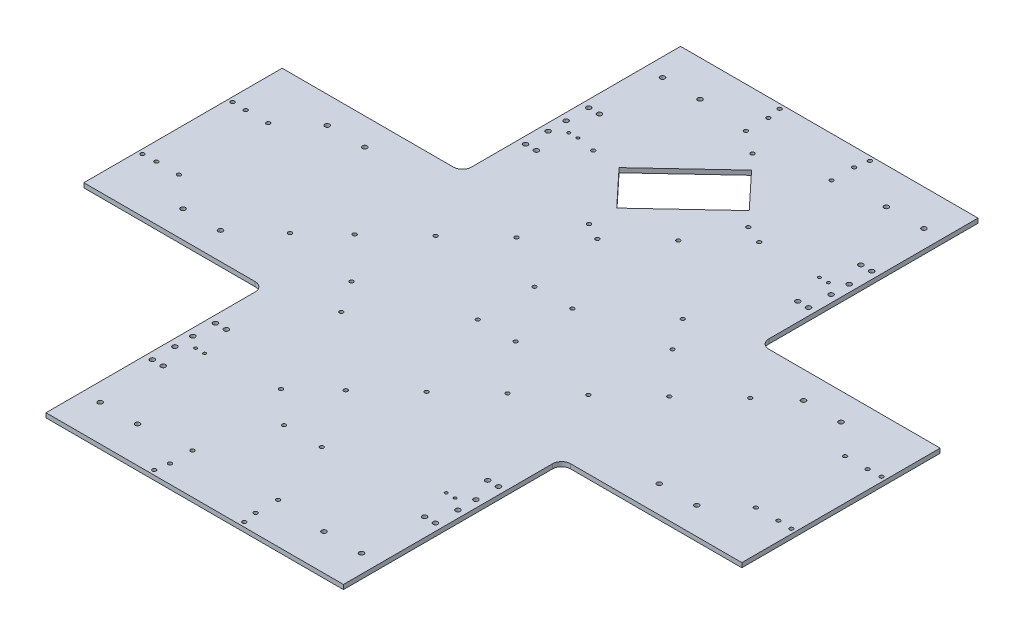
from build123d import *

# Parameters (mm, degrees)
BOSS_EXTRUDE1_DEPTH = 5
SKETCH2_R           = 2.125
CUT_EXTRUDE1_DEPTH  = 3
SKETCH4_R           = 2.6
SKETCH4_R_2         = 1.6
CUT_EXTRUDE3_DEPTH  = 10
SKETCH5_R           = 2.125
CUT_EXTRUDE4_DEPTH  = 10
FILLET1_R           = 10
SKETCH6_R           = 2.6
CUT_EXTRUDE5_DEPTH  = 10
SKETCH7_R           = 2.125
CUT_EXTRUDE6_DEPTH  = 10
SKETCH9_R           = 2.1
CUT_EXTRUDE7_DEPTH  = 10
SKETCH10_R          = 2.125
CUT_EXTRUDE8_DEPTH  = 10
SKETCH11_R          = 2.125
CUT_EXTRUDE9_DEPTH  = 10


with BuildPart() as part:
    # Sketch1 → Boss-Extrude1 (new body)
    with BuildSketch(Plane(origin=(0, 0, 0), x_dir=(1, 0, 0), z_dir=(0, 1, 0))):
        Polygon((165, 352), (-165, 352), (-165, 110), (-365, 110), (-365, -110), (-165, -110), (-165, -352), (165, -352), (165, -110), (365, -110), (365, 110), (165, 110), align=None)
    extrude(amount=BOSS_EXTRUDE1_DEPTH)

    # Sketch2 → Cut-Extrude1 (cut)
    with BuildSketch(Plane(origin=(0, 5, 0), x_dir=(1, 0, 0), z_dir=(0, 1, 0))):
        with Locations((345, 49.5)):
            Circle(SKETCH2_R)
        with Locations((320, 49.5)):
            Circle(SKETCH2_R)
        with Locations((320, -49.5)):
            Circle(SKETCH2_R)
        with Locations((345, -49.5)):
            Circle(SKETCH2_R)
        with Locations((-345, -49.5)):
            Circle(SKETCH2_R)
        with Locations((-320, -49.5)):
            Circle(SKETCH2_R)
        with Locations((-320, 49.5)):
            Circle(SKETCH2_R)
        with Locations((-345, 49.5)):
            Circle(SKETCH2_R)
        with Locations((47.5, 332)):
            Circle(SKETCH2_R)
        with Locations((47.5, 307)):
            Circle(SKETCH2_R)
        with Locations((-47.5, 307)):
            Circle(SKETCH2_R)
        with Locations((-47.5, 332)):
            Circle(SKETCH2_R)
        with Locations((-47.5, -332)):
            Circle(SKETCH2_R)
        with Locations((-47.5, -307)):
            Circle(SKETCH2_R)
        with Locations((47.5, -307)):
            Circle(SKETCH2_R)
        with Locations((47.5, -332)):
            Circle(SKETCH2_R)
    extrude(amount=-CUT_EXTRUDE1_DEPTH, mode=Mode.SUBTRACT)

    # Sketch4 → Cut-Extrude3 (cut)
    with BuildSketch(Plane(origin=(0, 5, 0), x_dir=(1, 0, 0), z_dir=(0, 1, 0))):
        with Locations((-157, 172)):
            Circle(SKETCH4_R)
        with Locations((-145, 172)):
            Circle(SKETCH4_R)
        with Locations((-157, 197)):
            Circle(SKETCH4_R)
        with Locations((-157, 217)):
            Circle(SKETCH4_R)
        with Locations((-157, 242)):
            Circle(SKETCH4_R)
        with Locations((-145, 242)):
            Circle(SKETCH4_R)
        with Locations((145, 242)):
            Circle(SKETCH4_R)
        with Locations((157, 242)):
            Circle(SKETCH4_R)
        with Locations((157, 217)):
            Circle(SKETCH4_R)
        with Locations((157, 197)):
            Circle(SKETCH4_R)
        with Locations((145, 172)):
            Circle(SKETCH4_R)
        with Locations((157, 172)):
            Circle(SKETCH4_R)
        with Locations((157, -172)):
            Circle(SKETCH4_R)
        with Locations((145, -172)):
            Circle(SKETCH4_R)
        with Locations((157, -197)):
            Circle(SKETCH4_R)
        with Locations((157, -217)):
            Circle(SKETCH4_R)
        with Locations((157, -242)):
            Circle(SKETCH4_R)
        with Locations((145, -242)):
            Circle(SKETCH4_R)
        with Locations((-145, -242)):
            Circle(SKETCH4_R)
        with Locations((-157, -242)):
            Circle(SKETCH4_R)
        with Locations((-157, -217)):
            Circle(SKETCH4_R)
        with Locations((-157, -197)):
            Circle(SKETCH4_R)
        with Locations((-145, -172)):
            Circle(SKETCH4_R)
        with Locations((-157, -172)):
            Circle(SKETCH4_R)
        with Locations((144, -207)):
            Circle(SKETCH4_R_2)
        with Locations((-144, -207)):
            Circle(SKETCH4_R_2)
        with Locations((144, 207)):
            Circle(SKETCH4_R_2)
        with Locations((-144, 207)):
            Circle(SKETCH4_R_2)
        with Locations((134, -207)):
            Circle(SKETCH4_R_2)
        with Locations((-134, -207)):
            Circle(SKETCH4_R_2)
        with Locations((134, 207)):
            Circle(SKETCH4_R_2)
        with Locations((-134, 207)):
            Circle(SKETCH4_R_2)
    extrude(amount=-CUT_EXTRUDE3_DEPTH, mode=Mode.SUBTRACT)

    # Sketch5 → Cut-Extrude4 (cut)
    with BuildSketch(Plane(origin=(0, 5, 0), x_dir=(1, 0, 0), z_dir=(0, 1, 0))):
        with Locations((-50, 347)):
            Circle(SKETCH5_R)
        with Locations((50, 347)):
            Circle(SKETCH5_R)
        with Locations((50, -347)):
            Circle(SKETCH5_R)
        with Locations((-50, -347)):
            Circle(SKETCH5_R)
        with Locations((-360, 50)):
            Circle(SKETCH5_R)
        with Locations((-360, -50)):
            Circle(SKETCH5_R)
        with Locations((360, -50)):
            Circle(SKETCH5_R)
        with Locations((360, 50)):
            Circle(SKETCH5_R)
    extrude(amount=-CUT_EXTRUDE4_DEPTH, mode=Mode.SUBTRACT)

    # Fillet1
    fillet1_edges = [part.edges().sort_by_distance(p)[0] for p in [
        (-165, 2.5, -110),
        (-165, 2.5, 110),
        (165, 2.5, 110),
        (165, 2.5, -110),
    ]]
    fillet(fillet1_edges, radius=FILLET1_R)

    # Sketch6 → Cut-Extrude5 (cut)
    with BuildSketch(Plane(origin=(0, 5, 0), x_dir=(1, 0, 0), z_dir=(0, 1, 0))):
        with Locations((-145, 312)):
            Circle(SKETCH6_R)
        with Locations((-103.4, 312)):
            Circle(SKETCH6_R)
        with Locations((103.4, 312)):
            Circle(SKETCH6_R)
        with Locations((145, 312)):
            Circle(SKETCH6_R)
        with Locations((145, -312)):
            Circle(SKETCH6_R)
        with Locations((103.4, -312)):
            Circle(SKETCH6_R)
        with Locations((-103.4, -312)):
            Circle(SKETCH6_R)
        with Locations((-145, -312)):
            Circle(SKETCH6_R)
        with Locations((243.4, 80)):
            Circle(SKETCH6_R)
        with Locations((285, 80)):
            Circle(SKETCH6_R)
        with Locations((285, -80)):
            Circle(SKETCH6_R)
        with Locations((243.4, -80)):
            Circle(SKETCH6_R)
        with Locations((-243.4, -80)):
            Circle(SKETCH6_R)
        with Locations((-285, -80)):
            Circle(SKETCH6_R)
        with Locations((-285, 80)):
            Circle(SKETCH6_R)
        with Locations((-243.4, 80)):
            Circle(SKETCH6_R)
    extrude(amount=-CUT_EXTRUDE5_DEPTH, mode=Mode.SUBTRACT)

    # Sketch7 → Cut-Extrude6 (cut)
    with BuildSketch(Plane(origin=(0, 5, 0), x_dir=(1, 0, 0), z_dir=(0, 1, 0))):
        with Locations((-72.423012394, 77.400951388)):
            Circle(SKETCH7_R)
        with Locations((-26.055461327, 120.786435228)):
            Circle(SKETCH7_R)
        with Locations((20.31208974, 164.171919068)):
            Circle(SKETCH7_R)
        with Locations((66.679640807, 207.557402908)):
            Circle(SKETCH7_R)
        with Locations((-118.790563461, 34.015467548)):
            Circle(SKETCH7_R)
        with Locations((-165.158114529, -9.370016292)):
            Circle(SKETCH7_R)
        with Locations((-202.252155383, -44.078403364)):
            Circle(SKETCH7_R)
        with Locations((-57.406130594, -198.88030614)):
            Circle(SKETCH7_R)
        with Locations((-20.31208974, -164.171919068)):
            Circle(SKETCH7_R)
        with Locations((26.055461327, -120.786435228)):
            Circle(SKETCH7_R)
        with Locations((211.525665596, 52.755500132)):
            Circle(SKETCH7_R)
        with Locations((165.158114529, 9.370016292)):
            Circle(SKETCH7_R)
        with Locations((118.790563461, -34.015467548)):
            Circle(SKETCH7_R)
        with Locations((72.423012394, -77.400951388)):
            Circle(SKETCH7_R)
    extrude(amount=-CUT_EXTRUDE6_DEPTH, mode=Mode.SUBTRACT)

    # Sketch9 → Cut-Extrude7 (cut)
    with BuildSketch(Plane(origin=(0, 5, 0), x_dir=(1, 0, 0), z_dir=(0, 1, 0))):
        with Locations((-121.560496485, -56.440276951)):
            Circle(SKETCH9_R)
        with Locations((-98.122996746, -91.292588295)):
            Circle(SKETCH9_R)
        with Locations((98.122996746, 91.292588295)):
            Circle(SKETCH9_R)
        with Locations((121.560496485, 56.440276951)):
            Circle(SKETCH9_R)
        with Locations((21, 232)):
            Circle(SKETCH9_R)
        with Locations((-21, 232)):
            Circle(SKETCH9_R)
        with Locations((-21, -232)):
            Circle(SKETCH9_R)
        with Locations((21, -232)):
            Circle(SKETCH9_R)
    extrude(amount=-CUT_EXTRUDE7_DEPTH, mode=Mode.SUBTRACT)

    # Sketch10 → Cut-Extrude8 (cut)
    with BuildSketch(Plane(origin=(0, 5, 0), x_dir=(1, 0, 0), z_dir=(0, 1, 0))):
        with Locations((46.274706825, 215.854629257)):
            Circle(SKETCH10_R)
        with Locations((-45, 130.450133509)):
            Circle(SKETCH10_R)
        with Locations((-113.323596598, 203.469898969)):
            Circle(SKETCH10_R)
        with Locations((-22.048889773, 288.874394717)):
            Circle(SKETCH10_R)
        Polygon((-6.676080538, 272.444947489), (30.901897591, 232.284076485), (-45.038658488, 161.227536023), (-82.616636617, 201.388407026), align=None)
    extrude(amount=-CUT_EXTRUDE8_DEPTH, mode=Mode.SUBTRACT)

    # Sketch11 → Cut-Extrude9 (cut)
    with BuildSketch(Plane(origin=(0, 5, 0), x_dir=(1, 0, 0), z_dir=(0, 1, 0))):
        with Locations((-15, 40)):
            Circle(SKETCH11_R)
        with Locations((27, 40)):
            Circle(SKETCH11_R)
        with Locations((-15, -23)):
            Circle(SKETCH11_R)
        with Locations((27, -23)):
            Circle(SKETCH11_R)
    extrude(amount=-CUT_EXTRUDE9_DEPTH, mode=Mode.SUBTRACT)


solid = part.part
